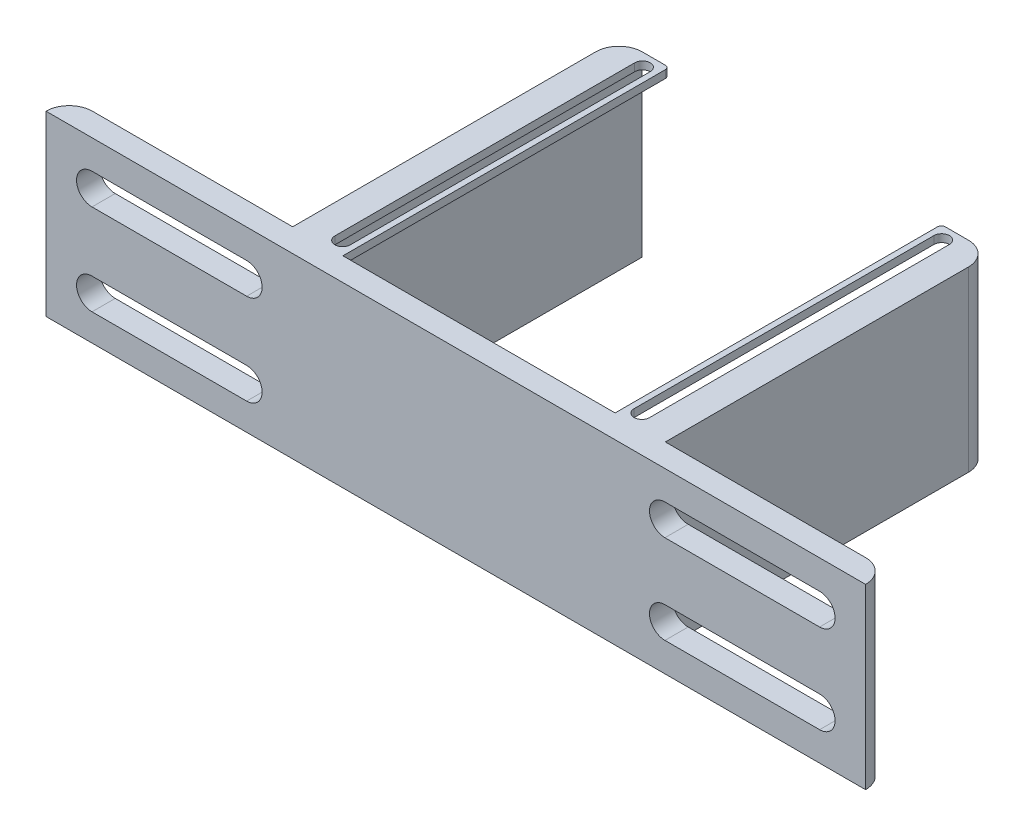
from build123d import *

# Parameters (mm, degrees)
BOSS_EXTRUDE5_DEPTH = 23
SKETCH3_W           = 3.5
SKETCH3_H           = 1
BOSS_EXTRUDE7_DEPTH = 42.2
CUT_EXTRUDE3_DEPTH  = 42.2
CUT_EXTRUDE4_DEPTH  = 42.2
FILLET1_R           = 3
FILLET2_R           = 3
FILLET3_R           = 0.5
FILLET4_R           = 0.5
FILLET5_R           = 3
FILLET6_R           = 3
CUT_EXTRUDE5_DEPTH  = 42.2
CUT_EXTRUDE6_DEPTH  = 42.2
CUT_EXTRUDE7_DEPTH  = 42.2


with BuildPart() as part:
    # Sketch1 → Boss-Extrude5 (new body)
    with BuildSketch(Plane(origin=(0, 0, 0), x_dir=(1, 0, 0), z_dir=(0, 1, 0))):
        Polygon((-53, 0), (53, 0), (53, 3), (24.1, 3), (24.1, 45.2), (21.1, 45.2), (21.1, 3), (-21.1, 3), (-21.1, 45.2), (-24.1, 45.2), (-24.1, 3), (-53, 3), align=None)
    extrude(amount=BOSS_EXTRUDE5_DEPTH)

    # Sketch3 → Boss-Extrude7 (add)
    with BuildSketch(Plane(origin=(0, 0, -3), x_dir=(-1, 0, 0), z_dir=(0, 0, -1))):
        with Locations((-19.35, 22.5)):
            Rectangle(SKETCH3_W, SKETCH3_H)
        with Locations((19.35, 22.5)):
            Rectangle(SKETCH3_W, SKETCH3_H)
    extrude(amount=BOSS_EXTRUDE7_DEPTH)

    # Sketch5 → Cut-Extrude3 (cut)
    with BuildSketch(Plane(origin=(0, 22, 0), x_dir=(-1, 0, 0), z_dir=(0, -1, 0))):
        with BuildLine():
            Line((-18.35, 43.490720045), (-18.35, 4.709279955))
            ThreePointArc((-18.35, 4.709279955), (-19.35, 3.709279955), (-20.35, 4.709279955))
            Line((-20.35, 4.709279955), (-20.35, 43.490720045))
            ThreePointArc((-20.35, 43.490720045), (-19.35, 44.490720045), (-18.35, 43.490720045))
        make_face()
    extrude(amount=-CUT_EXTRUDE3_DEPTH, mode=Mode.SUBTRACT)

    # Sketch5<4> → Cut-Extrude4 (cut)
    with BuildSketch(Plane(origin=(0, 22, 0), x_dir=(-1, 0, 0), z_dir=(0, -1, 0))):
        with BuildLine():
            Line((18.35, 4.709279955), (18.35, 43.490720045))
            ThreePointArc((18.35, 43.490720045), (19.35, 44.490720045), (20.35, 43.490720045))
            Line((20.35, 43.490720045), (20.35, 4.709279955))
            ThreePointArc((20.35, 4.709279955), (19.35, 3.709279955), (18.35, 4.709279955))
        make_face()
    extrude(amount=-CUT_EXTRUDE4_DEPTH, mode=Mode.SUBTRACT)

    # Fillet1
    fillet1_edges = [part.edges().sort_by_distance(p)[0] for p in [
        (-24.1, 11.5, -45.2),
    ]]
    fillet(fillet1_edges, radius=FILLET1_R)

    # Fillet2
    fillet2_edges = [part.edges().sort_by_distance(p)[0] for p in [
        (24.1, 11.5, -45.2),
    ]]
    fillet(fillet2_edges, radius=FILLET2_R)

    # Fillet3
    fillet3_edges = [part.edges().sort_by_distance(p)[0] for p in [
        (-17.6, 22.5, -45.2),
    ]]
    fillet(fillet3_edges, radius=FILLET3_R)

    # Fillet4
    fillet4_edges = [part.edges().sort_by_distance(p)[0] for p in [
        (17.6, 22.5, -45.2),
    ]]
    fillet(fillet4_edges, radius=FILLET4_R)

    # Fillet5
    fillet5_edges = [part.edges().sort_by_distance(p)[0] for p in [
        (53, 11.5, -3),
    ]]
    fillet(fillet5_edges, radius=FILLET5_R - 0.0001)  # a hair under: the kernel refuses the full size

    # Fillet6
    fillet6_edges = [part.edges().sort_by_distance(p)[0] for p in [
        (-53, 11.5, -3),
    ]]
    fillet(fillet6_edges, radius=FILLET6_R - 0.0001)  # a hair under: the kernel refuses the full size

    # Sketch6 → Cut-Extrude5 (cut)
    with BuildSketch(Plane(origin=(0, 0, -3), x_dir=(-1, 0, 0), z_dir=(0, 0, -1))):
        with BuildLine():
            Line((-27.05, 15.25), (-47.05, 15.25))
            ThreePointArc((-47.05, 15.25), (-49.05, 17.25), (-47.05, 19.25))
            Line((-47.05, 19.25), (-27.05, 19.25))
            ThreePointArc((-27.05, 19.25), (-25.05, 17.25), (-27.05, 15.25))
        make_face()
        with BuildLine():
            Line((-27.05, 3.75), (-47.05, 3.75))
            ThreePointArc((-47.05, 3.75), (-49.05, 5.75), (-47.05, 7.75))
            Line((-47.05, 7.75), (-27.05, 7.75))
            ThreePointArc((-27.05, 7.75), (-25.05, 5.75), (-27.05, 3.75))
        make_face()
    extrude(amount=-CUT_EXTRUDE5_DEPTH, mode=Mode.SUBTRACT)

    # Sketch7 → Cut-Extrude6 (cut)
    with BuildSketch(Plane(origin=(0, 0, -3), x_dir=(-1, 0, 0), z_dir=(0, 0, -1))):
        with BuildLine():
            Line((47.05, 15.25), (27.05, 15.25))
            ThreePointArc((27.05, 15.25), (25.05, 17.25), (27.05, 19.25))
            Line((27.05, 19.25), (47.05, 19.25))
            ThreePointArc((47.05, 19.25), (49.05, 17.25), (47.05, 15.25))
        make_face()
    extrude(amount=-CUT_EXTRUDE6_DEPTH, mode=Mode.SUBTRACT)

    # Sketch7<3> → Cut-Extrude7 (cut)
    with BuildSketch(Plane(origin=(0, 0, -3), x_dir=(-1, 0, 0), z_dir=(0, 0, -1))):
        with BuildLine():
            Line((27.05, 7.503040911), (47.05, 7.503040911))
            ThreePointArc((47.05, 7.503040911), (49.05, 5.503040911), (47.05, 3.503040911))
            Line((47.05, 3.503040911), (27.05, 3.503040911))
            ThreePointArc((27.05, 3.503040911), (25.05, 5.503040911), (27.05, 7.503040911))
        make_face()
    extrude(amount=-CUT_EXTRUDE7_DEPTH, mode=Mode.SUBTRACT)


solid = part.part
